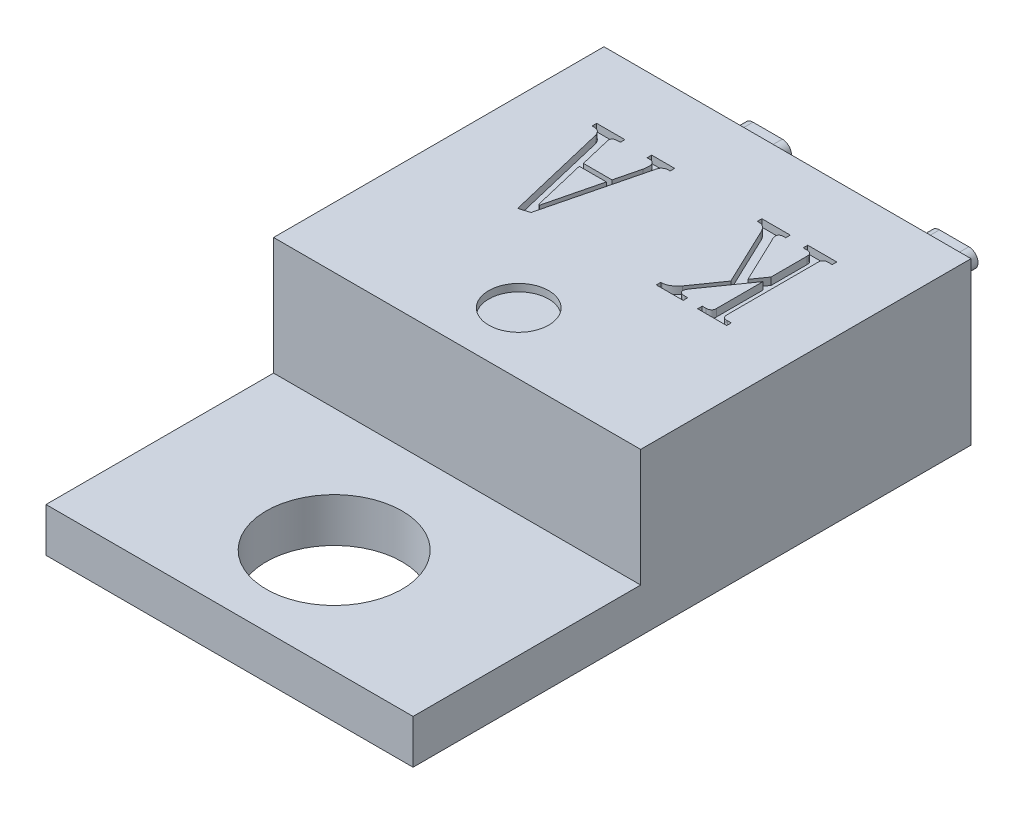
from build123d import *

# Parameters (mm, degrees)
SKETCH_1_W          = 10
SKETCH_1_H          = 4.4
EXTRUDE_1_DEPTH     = 15.2
SKETCH_2_W          = 6.2
SKETCH_2_H          = 3.2
CUT_EXTRUDE_1_DEPTH = 19.718974331
CUT_EXTRUDE_2_REACH = 20.719
SKETCH_3_R          = 1.85
SKETCH_4_R          = 0.816532351
CUT_EXTRUDE_3_DEPTH = 0.2
EXTRUDE_2_DEPTH     = 2
WRAP_START          = -0.2
WRAP_1_DEPTH        = 0.2


# Read off the part's stored shape, not the designer's step: 包覆1
with BuildPart() as part:
    # 草图1 → 凸台-拉伸1 (new body)
    with BuildSketch(Plane.XY):
        with Locations((5, 2.2)):
            Rectangle(SKETCH_1_W, SKETCH_1_H)
    extrude(amount=EXTRUDE_1_DEPTH)

    # 草图2 → 切除-拉伸1 (cut, through all)
    with BuildSketch(Plane(origin=(10, 0, 0), x_dir=(0, 0, -1), z_dir=(1, 0, 0))):
        with Locations((-12.1, 2.8)):
            Rectangle(SKETCH_2_W, SKETCH_2_H)
    extrude(amount=-CUT_EXTRUDE_1_DEPTH, mode=Mode.SUBTRACT)

    # 草图3 → 切除-拉伸2 (cut, up to next)
    with BuildSketch(Plane.XZ, mode=Mode.PRIVATE) as cut_extrude_2_sk1:
        with Locations(Location((5, 12.35, 0), (0, 0, 270))):
            Circle(SKETCH_3_R)
    cut_extrude_2_tool1 = extrude(cut_extrude_2_sk1.sketch, amount=-CUT_EXTRUDE_2_REACH, mode=Mode.PRIVATE) & part.part
    add(cut_extrude_2_tool1.solids().sort_by_distance((5, 0, 12.35))[0], mode=Mode.SUBTRACT)

    # 草图4 → 切除-拉伸3 (cut)
    with BuildSketch(Plane(origin=(0, 4.4, 0), x_dir=(-1, 0, 0), z_dir=(0, 1, 0))):
        with Locations((-5, 7.32228291)):
            Circle(SKETCH_4_R)
    extrude(amount=-CUT_EXTRUDE_3_DEPTH, mode=Mode.SUBTRACT)

    # 草图5 → 凸台-拉伸2 (add)
    with BuildSketch(Plane(origin=(0, 0, 0), x_dir=(-1, 0, 0), z_dir=(0, 0, -1))):
        with BuildLine():
            Line((-7.94, 2.65), (-7.14, 2.65))
            ThreePointArc((-7.14, 2.65), (-6.89, 2.4), (-7.14, 2.15))
            Line((-7.14, 2.15), (-7.94, 2.15))
            ThreePointArc((-7.94, 2.15), (-8.19, 2.4), (-7.94, 2.65))
        make_face()
        with BuildLine():
            Line((-2.06, 2.65), (-2.86, 2.65))
            ThreePointArc((-2.86, 2.65), (-3.11, 2.4), (-2.86, 2.15))
            Line((-2.86, 2.15), (-2.06, 2.15))
            ThreePointArc((-2.06, 2.15), (-1.81, 2.4), (-2.06, 2.65))
        make_face()
    extrude(amount=EXTRUDE_2_DEPTH)

    # 包覆1 outline → 包覆1 (cut)
    # profile 1 of 2: a face of its own
    with BuildSketch(Plane(origin=(0, 4.4, 0), x_dir=(1, 0, 0), z_dir=(0, 1, 0)).offset(WRAP_START)):
        with BuildLine():
            add(Edge.make_bspline(
                [(6.930989583, -2.031758229), (6.915107326, -2.032625879), (6.886212727, -2.034204394), (6.846667333, -2.045372179), (6.819228063, -2.069428088), (6.803221049, -2.101586149), (6.801017387, -2.141193863), (6.810949266, -2.186053613), (6.830123901, -2.237549844), (6.849896632, -2.272058221), (6.860677083, -2.290872813)],
                knots=[0, 0, 0, 0, 0.134063604, 0.243901978, 0.338487503, 0.432506005, 0.538929196, 0.665491452, 0.817619881, 1, 1, 1, 1], degree=3))
            Line((6.930989583, -2.031758229), (6.983723958, -2.031758229))
            Line((6.983723958, -2.031758229), (6.983723958, -1.906758229))
            Line((6.983723958, -1.906758229), (6.208333333, -1.906758229))
            Line((6.208333333, -1.906758229), (6.208333333, -2.031758229))
            Line((6.208333333, -2.031758229), (6.295572917, -2.031758229))
            add(Edge.make_bspline(
                [(6.504557292, -2.221862396), (6.495929833, -2.205652704), (6.479665398, -2.175094288), (6.45244636, -2.133930793), (6.422954526, -2.101143884), (6.393052529, -2.075772209), (6.364287696, -2.056836396), (6.33849766, -2.04342026), (6.316216749, -2.033596626), (6.301937753, -2.032325038), (6.295572917, -2.031758229)],
                knots=[0, 0, 0, 0, 0.187742948, 0.353931892, 0.503213882, 0.637048905, 0.753995091, 0.854253228, 0.93503364, 1, 1, 1, 1], degree=3))
            Line((6.504557292, -2.221862396), (7.255859375, -3.800638438))
            Line((7.255859375, -3.800638438), (6.711588542, -4.574075938))
            add(Edge.make_bspline(
                [(6.367838542, -4.781758229), (6.382221439, -4.781136361), (6.411311872, -4.779878589), (6.454540631, -4.769294334), (6.498129706, -4.753858707), (6.541134976, -4.730459287), (6.584266179, -4.700950899), (6.627240555, -4.66479857), (6.670366285, -4.622362568), (6.697506142, -4.590571678), (6.711588542, -4.574075938)],
                knots=[0, 0, 0, 0, 0.103884895, 0.210114587, 0.320338877, 0.43759129, 0.56296606, 0.6978075, 0.843197564, 1, 1, 1, 1], degree=3))
            Line((6.367838542, -4.781758229), (6.333333333, -4.781758229))
            Line((6.333333333, -4.781758229), (6.333333333, -4.906758229))
            Line((6.333333333, -4.906758229), (7.063802083, -4.906758229))
            Line((7.063802083, -4.906758229), (7.063802083, -4.781758229))
            Line((7.063802083, -4.781758229), (6.993489583, -4.781758229))
            add(Edge.make_bspline(
                [(6.888020833, -4.539570729), (6.875914449, -4.558101633), (6.854053882, -4.591562992), (6.832516724, -4.641371555), (6.825349297, -4.68501694), (6.834657735, -4.72263487), (6.859636327, -4.75025169), (6.89505428, -4.769644136), (6.941090575, -4.779777335), (6.974999933, -4.781059246), (6.993489583, -4.781758229)],
                knots=[0, 0, 0, 0, 0.178363102, 0.322071271, 0.434997506, 0.529283499, 0.62366698, 0.72638665, 0.850807703, 1, 1, 1, 1], degree=3))
            Line((6.888020833, -4.539570729), (7.708333333, -3.374206146))
            Line((7.708333333, -3.374206146), (7.708333333, -4.642435313))
            add(Edge.make_bspline(
                [(7.55859375, -4.781758229), (7.569261505, -4.781466132), (7.589734391, -4.780905556), (7.618905697, -4.774334821), (7.644615767, -4.763072355), (7.667304115, -4.748054599), (7.686035697, -4.728256372), (7.69919622, -4.703300066), (7.707027639, -4.674151855), (7.707884523, -4.653337332), (7.708333333, -4.642435313)],
                knots=[0, 0, 0, 0, 0.137639342, 0.264148789, 0.383430361, 0.498519415, 0.613574313, 0.731497168, 0.859366305, 1, 1, 1, 1], degree=3))
            Line((7.55859375, -4.781758229), (7.458333333, -4.781758229))
            Line((7.458333333, -4.781758229), (7.458333333, -4.906758229))
            Line((7.458333333, -4.906758229), (8.25, -4.906758229))
            Line((8.25, -4.906758229), (8.25, -4.781758229))
            Line((8.25, -4.781758229), (8.149739583, -4.781758229))
            add(Edge.make_bspline(
                [(8, -4.643086354), (8.000247716, -4.65398027), (8.000713759, -4.674475698), (8.007493922, -4.70308304), (8.017717416, -4.727550741), (8.032366625, -4.748243586), (8.05327597, -4.763833527), (8.080059672, -4.774757464), (8.113000414, -4.780982371), (8.136907743, -4.781487246), (8.149739583, -4.781758229)],
                knots=[0, 0, 0, 0, 0.137957594, 0.25954853, 0.370573832, 0.47303595, 0.577150492, 0.696855208, 0.837292342, 1, 1, 1, 1], degree=3))
            Line((8, -4.643086354), (8, -2.170430104))
            add(Edge.make_bspline(
                [(8.149739583, -2.031758229), (8.136907977, -2.032029309), (8.113001084, -2.032534363), (8.080057551, -2.038758127), (8.053282295, -2.049685522), (8.032346439, -2.065264608), (8.017909992, -2.085832582), (8.007221233, -2.110117779), (8.000820991, -2.138857995), (8.00028302, -2.159546252), (8, -2.170430104)],
                knots=[0, 0, 0, 0, 0.162681349, 0.303095774, 0.422781134, 0.526878841, 0.629324391, 0.737809695, 0.862064713, 1, 1, 1, 1], degree=3))
            Line((8.149739583, -2.031758229), (8.25, -2.031758229))
            Line((8.25, -2.031758229), (8.25, -1.906758229))
            Line((8.25, -1.906758229), (7.458333333, -1.906758229))
            Line((7.458333333, -1.906758229), (7.458333333, -2.031758229))
            Line((7.458333333, -2.031758229), (7.55859375, -2.031758229))
            add(Edge.make_bspline(
                [(7.708333333, -2.170430104), (7.707872164, -2.159534741), (7.706991684, -2.138732927), (7.699369622, -2.109684264), (7.685819191, -2.085165103), (7.667326615, -2.065449868), (7.644609508, -2.05044744), (7.618907501, -2.039180676), (7.589733882, -2.032611175), (7.569261331, -2.03205042), (7.55859375, -2.031758229)],
                knots=[0, 0, 0, 0, 0.14098033, 0.269164641, 0.384913342, 0.500251829, 0.615624556, 0.735200135, 0.862021403, 1, 1, 1, 1], degree=3))
            Line((7.708333333, -2.170430104), (7.708333333, -3.156107188))
            Line((7.708333333, -3.156107188), (7.448567708, -3.525898854))
            Line((7.448567708, -3.525898854), (6.860677083, -2.290872813))
        make_face()
    # profile 2 of 2: a face of its own
    with BuildSketch(Plane(origin=(0, 4.4, 0), x_dir=(1, 0, 0), z_dir=(0, 1, 0)).offset(WRAP_START)):
        with BuildLine():
            add(Edge.make_bspline(
                [(3.418619792, -2.355325938), (3.423290626, -2.332189778), (3.432052726, -2.288788256), (3.436281258, -2.225966665), (3.432219716, -2.170311627), (3.419748545, -2.121523718), (3.397043855, -2.080672541), (3.361471203, -2.050596509), (3.313901494, -2.03475832), (3.27919164, -2.032811362), (3.260416667, -2.031758229)],
                knots=[0, 0, 0, 0, 0.164440403, 0.308476601, 0.437530233, 0.552061218, 0.657168364, 0.758108431, 0.86915797, 1, 1, 1, 1], degree=3))
            Line((3.418619792, -2.355325938), (3.251302083, -3.031758229))
            Line((3.251302083, -3.031758229), (2.47265625, -3.031758229))
            Line((2.47265625, -3.031758229), (2.284505208, -2.243346771))
            add(Edge.make_bspline(
                [(2.407552083, -2.031758229), (2.391667135, -2.032296875), (2.362566209, -2.033283664), (2.3231508, -2.042204366), (2.293092672, -2.059473632), (2.273233438, -2.084737484), (2.26487379, -2.11648377), (2.262976163, -2.153509682), (2.270537673, -2.196694946), (2.279598478, -2.226958202), (2.284505208, -2.243346771)],
                knots=[0, 0, 0, 0, 0.152863017, 0.280042176, 0.385019123, 0.480297622, 0.580749292, 0.695821655, 0.835277215, 1, 1, 1, 1], degree=3))
            Line((2.407552083, -2.031758229), (2.477864583, -2.031758229))
            Line((2.477864583, -2.031758229), (2.477864583, -1.906758229))
            Line((2.477864583, -1.906758229), (1.708333333, -1.906758229))
            Line((1.708333333, -1.906758229), (1.708333333, -2.031758229))
            Line((1.708333333, -2.031758229), (1.761067708, -2.031758229))
            add(Edge.make_bspline(
                [(1.972005208, -2.192565521), (1.966073989, -2.178707602), (1.9549211, -2.152649581), (1.933551487, -2.118325589), (1.911064572, -2.089505922), (1.884961055, -2.067865098), (1.857221348, -2.050878644), (1.826723244, -2.040325548), (1.794671237, -2.032437792), (1.772404332, -2.031987489), (1.761067708, -2.031758229)],
                knots=[0, 0, 0, 0, 0.158644365, 0.298310162, 0.425134921, 0.541996665, 0.653801398, 0.765979904, 0.880854674, 1, 1, 1, 1], degree=3))
            Line((1.972005208, -2.192565521), (2.639322917, -4.990091563))
            Line((2.639322917, -4.990091563), (2.918619792, -4.902851979))
            Line((2.918619792, -4.902851979), (3.587239583, -2.224466563))
            add(Edge.make_bspline(
                [(3.780598958, -2.031758229), (3.769253734, -2.032178513), (3.74688055, -2.033007326), (3.714560239, -2.042036162), (3.684338324, -2.05569344), (3.656371612, -2.074852871), (3.631282534, -2.10088588), (3.612447742, -2.135739762), (3.596389822, -2.177235982), (3.590420449, -2.208047958), (3.587239583, -2.224466563)],
                knots=[0, 0, 0, 0, 0.1127485, 0.22234404, 0.331662042, 0.442001332, 0.558219825, 0.688003095, 0.833747961, 1, 1, 1, 1], degree=3))
            Line((3.780598958, -2.031758229), (3.833333333, -2.031758229))
            Line((3.833333333, -2.031758229), (3.833333333, -1.906758229))
            Line((3.833333333, -1.906758229), (3.207682292, -1.906758229))
            Line((3.207682292, -1.906758229), (3.207682292, -2.031758229))
            Line((3.207682292, -2.031758229), (3.260416667, -2.031758229))
        make_face()
        Polygon((2.485026042, -3.156758229), (3.221354167, -3.156758229), (2.861979167, -4.612487396), (2.829427083, -4.604674896), align=None, mode=Mode.SUBTRACT)
    extrude(amount=WRAP_1_DEPTH, mode=Mode.SUBTRACT)


solid = part.part
